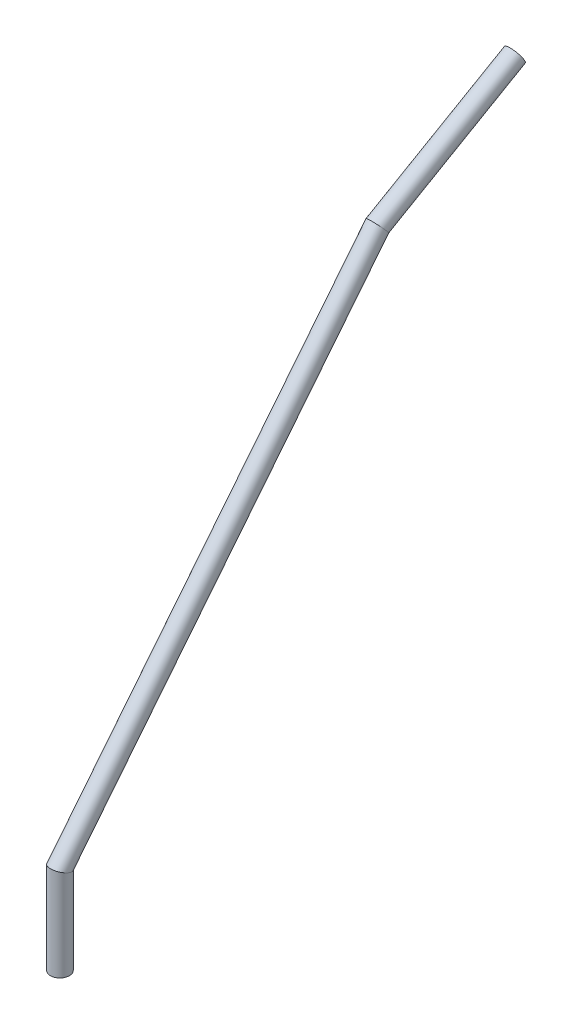
from build123d import *

# Parameters (mm, degrees)
SKETCH2_R          = 4.7625
SKETCH2_R_2        = 3.175
SKETCH11_W         = 4
SKETCH11_H         = 4.7625
CUT_EXTRUDE2_DEPTH = 8


with BuildPart() as part:
    # Sweep2: sweep along a path in Sketch4
    with BuildLine(Plane(origin=(0, 0, 0), x_dir=(0, 0, -1), z_dir=(1, 0, 0))) as sweep2_path:
        Line((8, 0), (8, 45))
        Line((8, 45), (168, 245))
        Line((168, 245), (237.282032303, 285))
    # Sketch2 → Sweep2 (sweep)
    with BuildSketch(Plane(origin=(0, 0, 0), x_dir=(1, 0, 0), z_dir=(0, 1, 0))):
        with Locations((0, 8)):
            Circle(SKETCH2_R)
        with Locations((0, 8)):
            Circle(SKETCH2_R_2, mode=Mode.SUBTRACT)
    sweep(path=sweep2_path.line, transition=Transition.RIGHT)

    # Sketch11 → Cut-Extrude2 (cut)
    with BuildSketch(Plane(origin=(0, 158.996133918, -275.389382153), x_dir=(1, 0, 0), z_dir=(0, 0.5000000000000016, -0.8660254037844378))):
        with Locations((0, -125.794973927)):
            Rectangle(SKETCH11_W, SKETCH11_H)
    extrude(amount=-CUT_EXTRUDE2_DEPTH, mode=Mode.SUBTRACT)


solid = part.part
